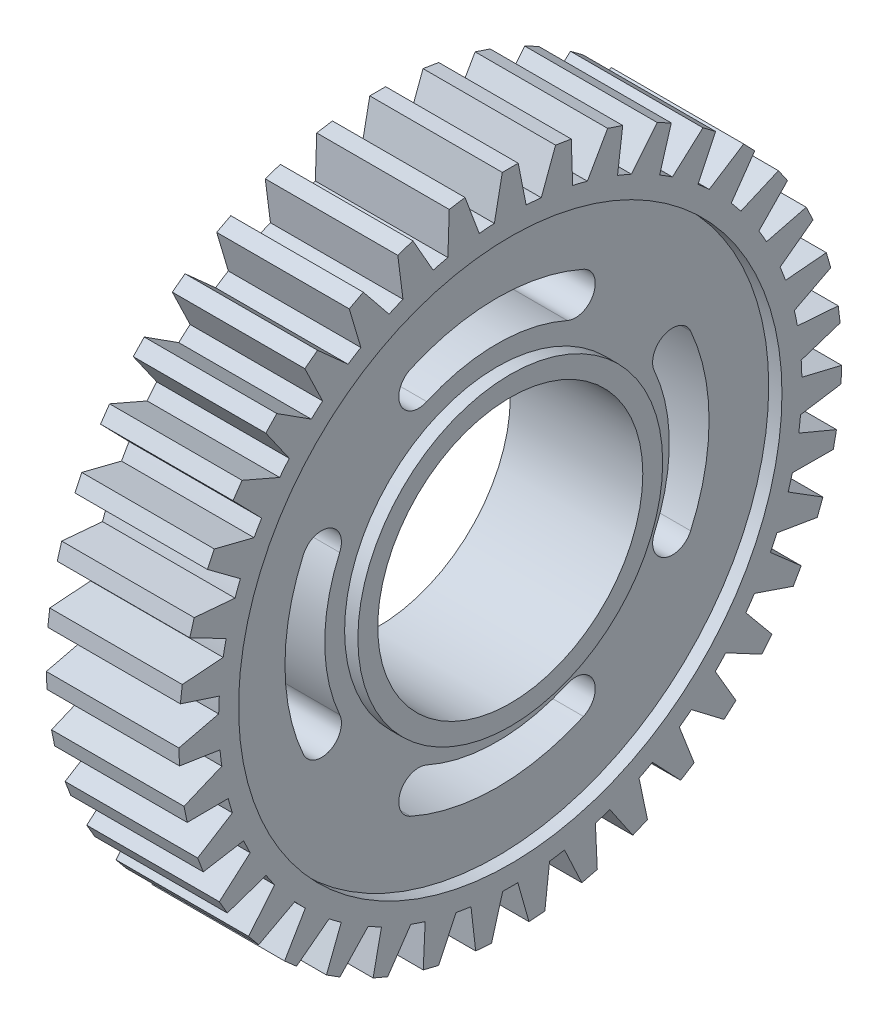
from build123d import *

# Parameters (mm, degrees)
SKETCH1_R           = 20.5
SKETCH1_R_2         = 16
SKETCH1_R_3         = 13
SKETCH1_R_4         = 10
SKETCH1_R_5         = 11.5
BOSS_EXTRUDE1_DEPTH = 4
SKETCH1_3_R         = 22
SKETCH1_3_R_2       = 20.5
SKETCH1_3_R_3       = 11.5
SKETCH1_3_R_4       = 10
BOSS_EXTRUDE2_DEPTH = 5
BOSS_EXTRUDE3_DEPTH = 5
CIRPATTERN2_COUNT   = 39
CUT_EXTRUDE1_DEPTH  = 37.485534682
FILLET1_START       = -4
FILLET1_DEPTH       = 8
FILLET2_START       = -4
FILLET2_DEPTH       = 8
CIRPATTERN3_COUNT   = 4


with BuildPart() as part:
    # Sketch1 → Boss-Extrude1 (new, symmetric)
    # profile 1 of 4: a face of its own
    with BuildSketch(Plane.YZ):
        with Locations(Location((0, 0, 0), (0, 0, 270))):
            Circle(SKETCH1_R)
        Circle(SKETCH1_R_2, mode=Mode.SUBTRACT)
    # profile 2 of 4: a face of its own
    with BuildSketch(Plane.YZ):
        Circle(SKETCH1_R_2)
        Circle(SKETCH1_R_3, mode=Mode.SUBTRACT)
    # profile 3 of 4: a face of its own
    with BuildSketch(Plane.YZ):
        Circle(SKETCH1_R_3)
        with Locations(Location((0, 0, 0), (0, 0, 270))):
            Circle(SKETCH1_R_4, mode=Mode.SUBTRACT)
    # profile 4 of 4: a face of its own
    with BuildSketch(Plane.YZ):
        Circle(SKETCH1_R_5)
        with Locations(Location((0, 0, 0), (0, 0, 270))):
            Circle(SKETCH1_R_4, mode=Mode.SUBTRACT)
    extrude(amount=BOSS_EXTRUDE1_DEPTH, both=True)

    # Sketch1<3> → Boss-Extrude2 (add, symmetric)
    # profile 1 of 2: a face of its own
    with BuildSketch(Plane.YZ):
        with Locations(Location((0, 0, 0), (0, 0, 270))):
            Circle(SKETCH1_3_R)
        with Locations(Location((0, 0, 0), (0, 0, 270))):
            Circle(SKETCH1_3_R_2, mode=Mode.SUBTRACT)
    # profile 2 of 2: a face of its own
    with BuildSketch(Plane.YZ):
        with Locations(Location((0, 0, 0), (0, 0, 270))):
            Circle(SKETCH1_3_R_3)
        with Locations(Location((0, 0, 0), (0, 0, 270))):
            Circle(SKETCH1_3_R_4, mode=Mode.SUBTRACT)
    extrude(amount=BOSS_EXTRUDE2_DEPTH, both=True)

    # Sketch1<4> → Boss-Extrude3 (add, symmetric)
    with BuildSketch(Plane.YZ):
        with BuildLine():
            Line((25, -0.6), (25, 0.6))
            Line((25, 0.6), (21.967248348, 1.2))
            ThreePointArc((21.967248348, 1.2), (21.991810563, 0.600223431), (22, 0))
            ThreePointArc((22, 0), (21.991810563, -0.600223431), (21.967248348, -1.2))
            Line((21.967248348, -1.2), (25, -0.6))
        make_face()
    boss_extrude3 = extrude(amount=BOSS_EXTRUDE3_DEPTH, both=True)

    # CirPattern2: Boss-Extrude3 ×39 about axis
    cirpattern2_axis = Axis((0, 0, 0), (1, 0, 0))
    for i in range(1, CIRPATTERN2_COUNT):
        add(boss_extrude3.rotate(cirpattern2_axis, i * 360 / CIRPATTERN2_COUNT))

    # Sketch2 → Cut-Extrude1 (cut, through all)
    with BuildSketch(Plane.YZ.offset(4)):
        with BuildLine():
            Line((-6.5, 11.258330249), (-8, 13.856406461))
            ThreePointArc((-8, 13.856406461), (0, 16), (8, 13.856406461))
            Line((8, 13.856406461), (6.5, 11.258330249))
            ThreePointArc((6.5, 11.258330249), (0, 13), (-6.5, 11.258330249))
        make_face()
    cut_extrude1 = extrude(amount=-CUT_EXTRUDE1_DEPTH, mode=Mode.SUBTRACT)

    # Fillet1: read off the stored shape, not the designer's step
    # Fillet1 outline → Fillet1 (add)
    with BuildSketch(Plane.YZ.offset(FILLET1_START)):
        with BuildLine():
            ThreePointArc((-6.5, 11.258330249), (-5.908165679, 11.579878165), (-5.300471571, 11.870341239))
            add(Edge.make_bspline(
                [(-5.300471571, 11.870341239), (-5.620971033, 11.727228395), (-6.029597711, 11.655683843), (-6.496578364, 11.727639413), (-6.932882317, 12.008104407), (-7.211102557, 12.489996008)],
                knots=[0, 0, 0, 0, 0, 0, 0.474068369, 0.474068369, 0.474068369, 0.474068369, 0.474068369, 0.474068369], degree=5, weights=[1, 0.810372652, 0.665693468, 0.565962448, 0.511179591, 0.501344899]))
            Line((-7.211102557, 12.489996008), (-6.5, 11.258330249))
        make_face()
        with BuildLine():
            Line((-8, 13.856406461), (-7.211102557, 12.489996008))
            add(Edge.make_bspline(
                [(-7.211102557, 12.489996008), (-7.532816375, 13.047220697), (-7.525071775, 13.652742609), (-7.25906479, 14.138057657), (-6.888560972, 14.446710078), (-6.523657318, 14.609650755)],
                knots=[0.474068369, 0.474068369, 0.474068369, 0.474068369, 0.474068369, 0.474068369, 1, 1, 1, 1, 1, 1], degree=5, weights=[0.501344899, 0.490434287, 0.534844491, 0.634575511, 0.789627348, 1]))
            ThreePointArc((-6.523657318, 14.609650755), (-7.271588528, 14.252157742), (-8, 13.856406461))
        make_face()
    fillet1 = extrude(amount=FILLET1_DEPTH)

    # Fillet2: read off the stored shape, not the designer's step
    # Fillet2 outline → Fillet2 (add)
    with BuildSketch(Plane.YZ.offset(FILLET2_START)):
        with BuildLine():
            ThreePointArc((8, 13.856406461), (7.271588528, 14.252157742), (6.523657319, 14.609650756))
            add(Edge.make_bspline(
                [(6.523657319, 14.609650756), (6.888562826, 14.44670925), (7.259068489, 14.138054575), (7.525075573, 13.652735679), (7.532816511, 13.047210101), (7.211096245, 12.489985075)],
                knots=[0, 0, 0, 0, 0, 0, 0.52593374, 0.52593374, 0.52593374, 0.52593374, 0.52593374, 0.52593374], degree=5, weights=[1, 0.789626504, 0.634574268, 0.534843291, 0.490433575, 0.501345118]))
            Line((7.211096245, 12.489985075), (8, 13.856406461))
        make_face()
        with BuildLine():
            Line((6.5, 11.258330249), (7.211096245, 12.489985075))
            add(Edge.make_bspline(
                [(7.211096245, 12.489985075), (6.932873718, 12.008098879), (6.496571031, 11.727638283), (6.029593284, 11.655684618), (5.620969274, 11.727229181), (5.300471572, 11.870341239)],
                knots=[0.52593374, 0.52593374, 0.52593374, 0.52593374, 0.52593374, 0.52593374, 1, 1, 1, 1, 1, 1], degree=5, weights=[0.501345118, 0.511180567, 0.565963779, 0.665694756, 0.810373496, 1]))
            ThreePointArc((5.300471572, 11.870341239), (5.908165679, 11.579878165), (6.5, 11.258330249))
        make_face()
    fillet2 = extrude(amount=FILLET2_DEPTH)

    # CirPattern3: Cut-Extrude1, Fillet1, Fillet2 ×4 about axis
    cirpattern3_axis = Axis((0, 0, 0), (-1, 0, 0))
    add([cut_extrude1.rotate(cirpattern3_axis, i * 360 / CIRPATTERN3_COUNT) for i in range(1, CIRPATTERN3_COUNT)], mode=Mode.SUBTRACT)
    add([fillet1.rotate(cirpattern3_axis, i * 360 / CIRPATTERN3_COUNT) for i in range(1, CIRPATTERN3_COUNT)])
    add([fillet2.rotate(cirpattern3_axis, i * 360 / CIRPATTERN3_COUNT) for i in range(1, CIRPATTERN3_COUNT)])


solid = part.part
